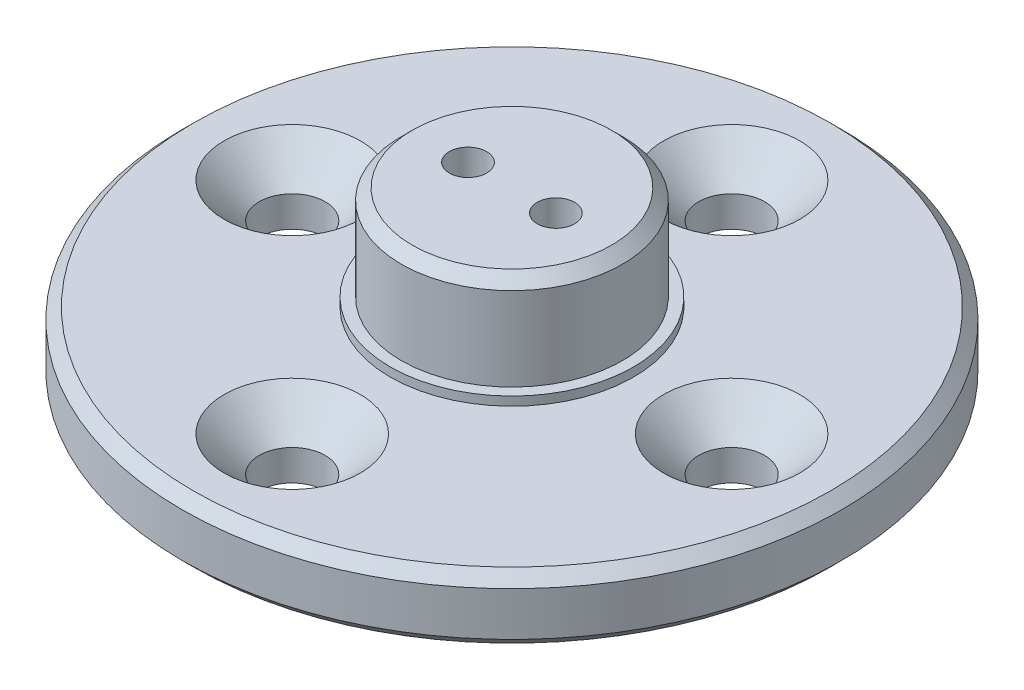
from build123d import *

# Parameters (mm, degrees)
SKETCH_1_R          = 15
SKETCH_1_R_2        = 1.5
EXTRUDE_1_DEPTH     = 3
SKETCH_2_R          = 5.035
SKETCH_2_R_2        = 0.85
EXTRUDE_2_DEPTH     = 4.7
SKETCH_4_R          = 5.535
EXTRUDE_3_DEPTH     = 0.4
CHAMFER_1_SIZE      = 0.5
CHAMFER_3_SIZE      = 0.5
CHAMFER_4_SIZE      = 1.6
CUT_EXTRUDE_START   = -10
SKETCH_5_R          = 0.85
CUT_EXTRUDE_1_DEPTH = 10


with BuildPart() as part:
    # 草图1 → 凸台-拉伸1 (new body)
    with BuildSketch(Plane(origin=(0, 0, 0), x_dir=(1, 0, 0), z_dir=(0, 1, 0))):
        Circle(SKETCH_1_R)
        with Locations((0, 10)):
            Circle(SKETCH_1_R_2, mode=Mode.SUBTRACT)
        with Locations((10, 0)):
            Circle(SKETCH_1_R_2, mode=Mode.SUBTRACT)
        with Locations((0, -10)):
            Circle(SKETCH_1_R_2, mode=Mode.SUBTRACT)
        with Locations((-10, 0)):
            Circle(SKETCH_1_R_2, mode=Mode.SUBTRACT)
    extrude(amount=EXTRUDE_1_DEPTH)

    # 草图2 → 凸台-拉伸2 (add)
    with BuildSketch(Plane(origin=(0, 3, 0), x_dir=(1, 0, 0), z_dir=(0, 1, 0))):
        Circle(SKETCH_2_R)
        with Locations((2, 0)):
            Circle(SKETCH_2_R_2, mode=Mode.SUBTRACT)
        with Locations((-2, 0)):
            Circle(SKETCH_2_R_2, mode=Mode.SUBTRACT)
    extrude(amount=EXTRUDE_2_DEPTH)

    # 草图4 → 凸台-拉伸3 (add)
    with BuildSketch(Plane(origin=(0, 3, 0), x_dir=(1, 0, 0), z_dir=(0, 1, 0))):
        Circle(SKETCH_4_R)
    extrude(amount=EXTRUDE_3_DEPTH)

    # 倒角1
    chamfer_1_edges = [part.edges().sort_by_distance(p)[0] for p in [
        (-5.035, 7.7, 0),
    ]]
    chamfer(chamfer_1_edges, length=CHAMFER_1_SIZE)

    # 倒角3
    chamfer_3_edges = [part.edges().sort_by_distance(p)[0] for p in [
        (-15, 0, 0),
        (-15, 3, 0),
    ]]
    chamfer(chamfer_3_edges, length=CHAMFER_3_SIZE)

    # 倒角4
    chamfer_4_edges = [part.edges().sort_by_distance(p)[0] for p in [
        (8.5, 3, 0),
        (-1.5, 3, 10),
        (-11.5, 3, 0),
        (-1.5, 3, -10),
    ]]
    chamfer(chamfer_4_edges, length=CHAMFER_4_SIZE)

    # 草图5 → 切除-拉伸1 (cut)
    with BuildSketch(Plane(origin=(0, 7.7, 0), x_dir=(1, 0, 0), z_dir=(0, 1, 0)).offset(CUT_EXTRUDE_START)):
        with Locations((2, 0)):
            Circle(SKETCH_5_R)
        with Locations((-2, 0)):
            Circle(SKETCH_5_R)
    extrude(amount=CUT_EXTRUDE_1_DEPTH, mode=Mode.SUBTRACT)


solid = part.part
